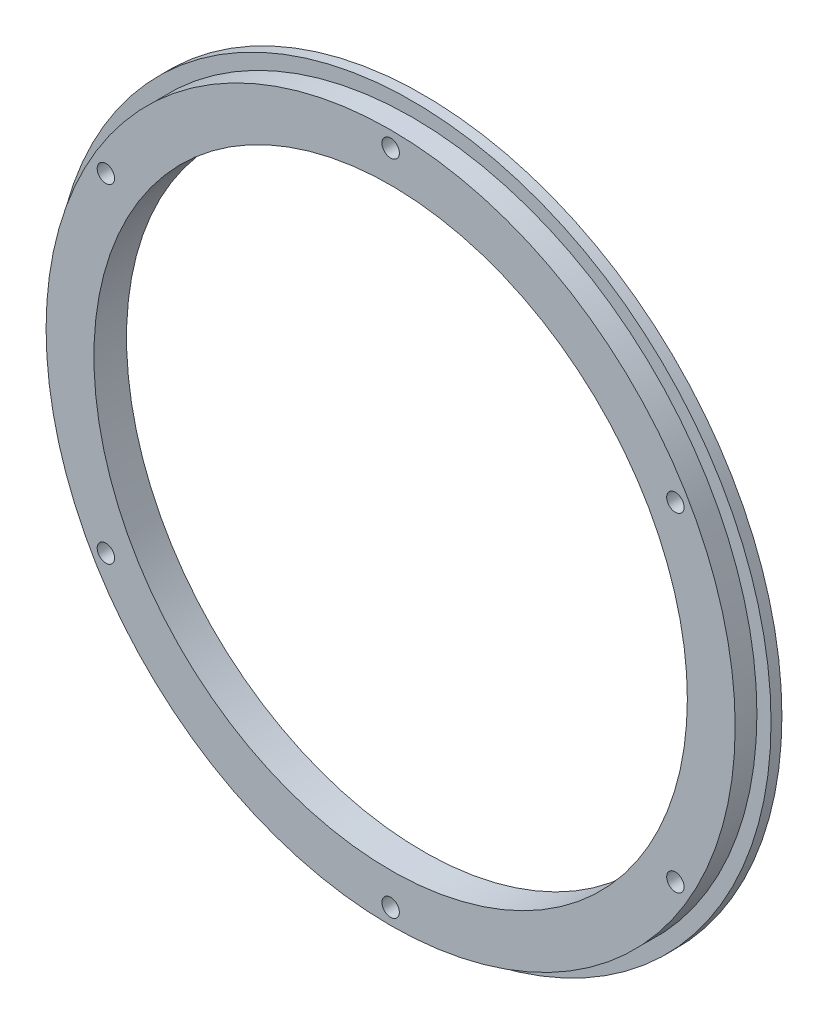
from build123d import *

# Parameters (mm, degrees)
SKETCH1_R           = 66
BOSS_EXTRUDE1_DEPTH = 2
SKETCH2_R           = 63.4
BOSS_EXTRUDE2_DEPTH = 4
SKETCH3_R           = 54.6
CUT_EXTRUDE1_DEPTH  = 10
SKETCH4_R           = 1.6
CUT_EXTRUDE2_DEPTH  = 10


with BuildPart() as part:
    # Sketch1 → Boss-Extrude1 (new body)
    with BuildSketch(Plane.XY):
        Circle(SKETCH1_R)
    extrude(amount=BOSS_EXTRUDE1_DEPTH)

    # Sketch2 → Boss-Extrude2 (add)
    with BuildSketch(Plane.XY.offset(2)):
        Circle(SKETCH2_R)
    extrude(amount=BOSS_EXTRUDE2_DEPTH)

    # Sketch3 → Cut-Extrude1 (cut)
    with BuildSketch(Plane.XY.offset(6)):
        Circle(SKETCH3_R)
    extrude(amount=-CUT_EXTRUDE1_DEPTH, mode=Mode.SUBTRACT)

    # Sketch4 → Cut-Extrude2 (cut)
    with BuildSketch(Plane.XY.offset(6)):
        with Locations((0, 60.5)):
            Circle(SKETCH4_R)
        with Locations((52.394536929, 30.25)):
            Circle(SKETCH4_R)
        with Locations((52.394536929, -30.25)):
            Circle(SKETCH4_R)
        with Locations((0, -60.5)):
            Circle(SKETCH4_R)
        with Locations((-52.394536929, -30.25)):
            Circle(SKETCH4_R)
        with Locations((-52.394536929, 30.25)):
            Circle(SKETCH4_R)
    extrude(amount=-CUT_EXTRUDE2_DEPTH, mode=Mode.SUBTRACT)


solid = part.part
